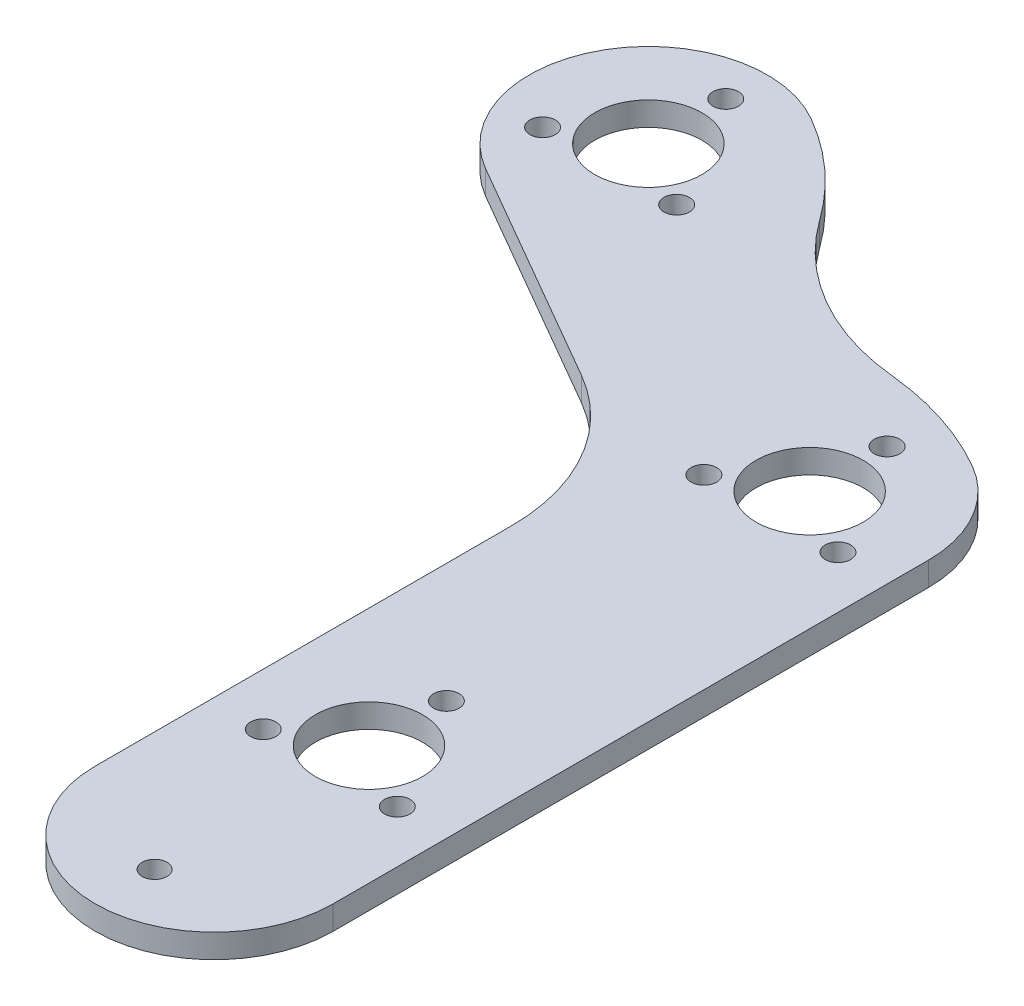
from build123d import *

# Parameters (mm, degrees)
SKETCH2_R           = 14.2875
SKETCH2_R_2         = 3.302
SKETCH2_R_3         = 3.3909
BOSS_EXTRUDE1_DEPTH = 6.35


with BuildPart() as part:
    # Sketch2 → Boss-Extrude1 (new body)
    with BuildSketch(Plane(origin=(0, 0, 0), x_dir=(1, 0, 0), z_dir=(0, 1, 0))):
        with BuildLine():
            Line((31.75, 20.031971953), (31.75, 117.475))
            ThreePointArc((31.75, 117.475), (27.49630657, 133.35), (15.875, 144.97130657))
            ThreePointArc((15.875, 144.97130657), (0.586402654, 151.746205548), (-15.788647281, 155.137105807))
            ThreePointArc((-15.788647281, 155.137105807), (-41.343167155, 163.341533942), (-61.22567028, 181.370183267))
            ThreePointArc((-61.22567028, 181.370183267), (-72.349801014, 193.855942369), (-85.86133431, 203.70880657))
            ThreePointArc((-85.86133431, 203.70880657), (-129.23264088, 192.0875), (-117.61133431, 148.71619343))
            Line((-117.61133431, 148.71619343), (-57.15, 113.808825791))
            ThreePointArc((-57.15, 113.808825791), (-38.555909488, 95.214735278), (-31.75, 69.814735278))
            Line((-31.75, 69.814735278), (-31.75, -41.275))
            ThreePointArc((-31.75, -41.275), (0, -73.025), (31.75, -41.275))
            Line((31.75, -41.275), (31.75, 20.031971953))
        make_face()
        Circle(SKETCH2_R, mode=Mode.SUBTRACT)
        with Locations((0, 117.475)):
            Circle(SKETCH2_R, mode=Mode.SUBTRACT)
        with Locations((-101.73633431, 176.2125)):
            Circle(SKETCH2_R, mode=Mode.SUBTRACT)
        with Locations((0, -57.15)):
            Circle(SKETCH2_R_2, mode=Mode.SUBTRACT)
        with Locations((-17.872599271, -10.31875)):
            Circle(SKETCH2_R_3, mode=Mode.SUBTRACT)
        with Locations((0, 20.6375)):
            Circle(SKETCH2_R_3, mode=Mode.SUBTRACT)
        with Locations((17.872599271, -10.31875)):
            Circle(SKETCH2_R_3, mode=Mode.SUBTRACT)
        with Locations((-17.872599271, 107.15625)):
            Circle(SKETCH2_R_3, mode=Mode.SUBTRACT)
        with Locations((-119.60893358, 165.89375)):
            Circle(SKETCH2_R_3, mode=Mode.SUBTRACT)
        with Locations((0, 138.1125)):
            Circle(SKETCH2_R_3, mode=Mode.SUBTRACT)
        with Locations((17.872599271, 107.15625)):
            Circle(SKETCH2_R_3, mode=Mode.SUBTRACT)
        with Locations((-101.73633431, 196.85)):
            Circle(SKETCH2_R_3, mode=Mode.SUBTRACT)
        with Locations((-83.863735039, 165.89375)):
            Circle(SKETCH2_R_3, mode=Mode.SUBTRACT)
    extrude(amount=BOSS_EXTRUDE1_DEPTH)


solid = part.part
